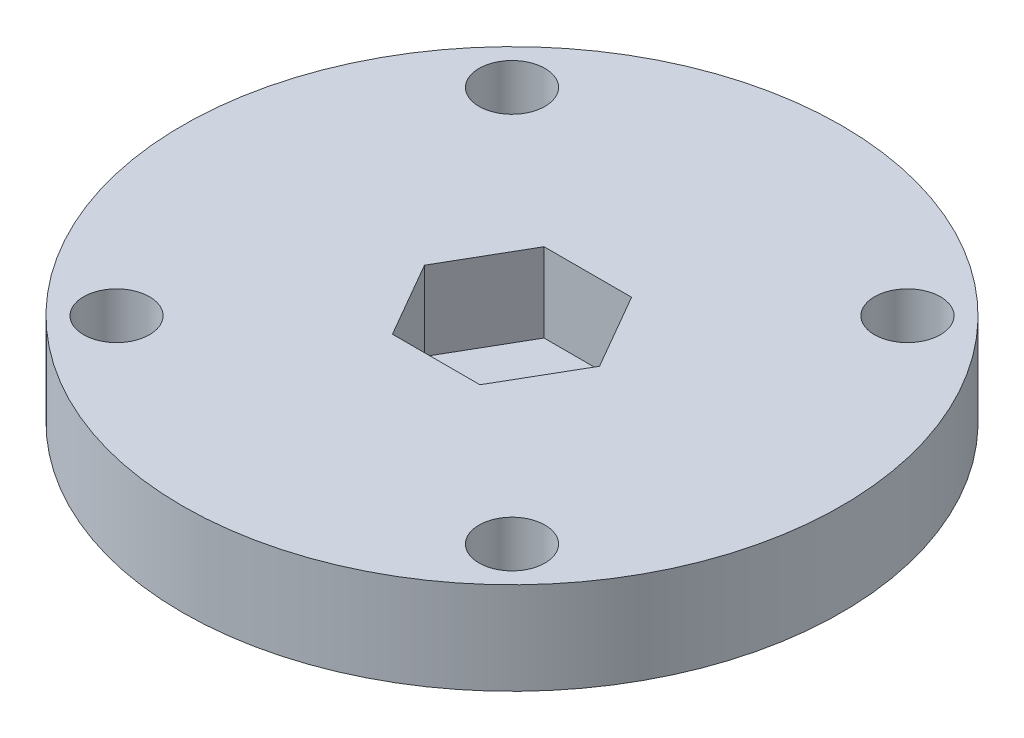
from build123d import *

# Parameters (mm, degrees)
SKETCH1_R           = 25
BOSS_EXTRUDE1_DEPTH = 5
SKETCH2_R           = 2.5
CUT_EXTRUDE1_DEPTH  = 36.707142143
CUT_EXTRUDE2_DEPTH  = 4
MOVE_FACE1_BY       = 2
MOVE_START          = 1
MOVE_FACE2_DEPTH    = 6


# Read off the part's stored shape, not the designer's step: Move Face2
with BuildPart() as part:
    # Sketch1 → Boss-Extrude1 (new body)
    with BuildSketch(Plane(origin=(0, 0, 0), x_dir=(1, 0, 0), z_dir=(0, 1, 0))):
        with Locations(Location((0, 0, 0), (0, 0, 270))):
            Circle(SKETCH1_R)
    extrude(amount=BOSS_EXTRUDE1_DEPTH)

    # Sketch2 → Cut-Extrude1 (cut, through all)
    with BuildSketch(Plane(origin=(0, 5, 0), x_dir=(1, 0, 0), z_dir=(0, 1, 0))):
        with Locations(Location((-15, 15, 0), (0, 0, 270))):
            Circle(SKETCH2_R)
        with Locations(Location((15, 15, 0), (0, 0, 270))):
            Circle(SKETCH2_R)
        with Locations(Location((15, -15, 0), (0, 0, 270))):
            Circle(SKETCH2_R)
        with Locations(Location((-15, -15, 0), (0, 0, 270))):
            Circle(SKETCH2_R)
    extrude(amount=-CUT_EXTRUDE1_DEPTH, mode=Mode.SUBTRACT)

    # Sketch7 → Cut-Extrude2 (cut)
    with BuildSketch(Plane(origin=(0, 5, 0), x_dir=(1, 0, 0), z_dir=(0, 1, 0))):
        Polygon((3.262029021, -5.65), (-3.262029021, -5.65), (-6.524058042, 0), (-3.262029021, 5.65), (3.262029021, 5.65), (6.524058042, 0), align=None)
    extrude(amount=-CUT_EXTRUDE2_DEPTH, mode=Mode.SUBTRACT)

    # Move Face1: a face moved outward by 2.0
    extrude(part.faces().sort_by_distance((0, 5, 12.5))[0], amount=MOVE_FACE1_BY, dir=(0, 1, 0))

    # Move Face2 outline → Move Face2 (cut)
    with BuildSketch(Plane(origin=(0, 0, 0), x_dir=(1, 0, 0), z_dir=(0, 1, 0)).offset(MOVE_START)):
        Polygon((-3.319764048, 5.75), (-6.639528096, 0), (-3.319764048, -5.75), (3.319764048, -5.75), (6.639528096, 0), (3.319764048, 5.75), align=None)
        Polygon((-3.262029021, -5.65), (-6.524058042, 0), (-3.262029021, 5.65), (3.262029021, 5.65), (6.524058042, 0), (3.262029021, -5.65), align=None, mode=Mode.SUBTRACT)
    extrude(amount=MOVE_FACE2_DEPTH, mode=Mode.SUBTRACT)


solid = part.part
